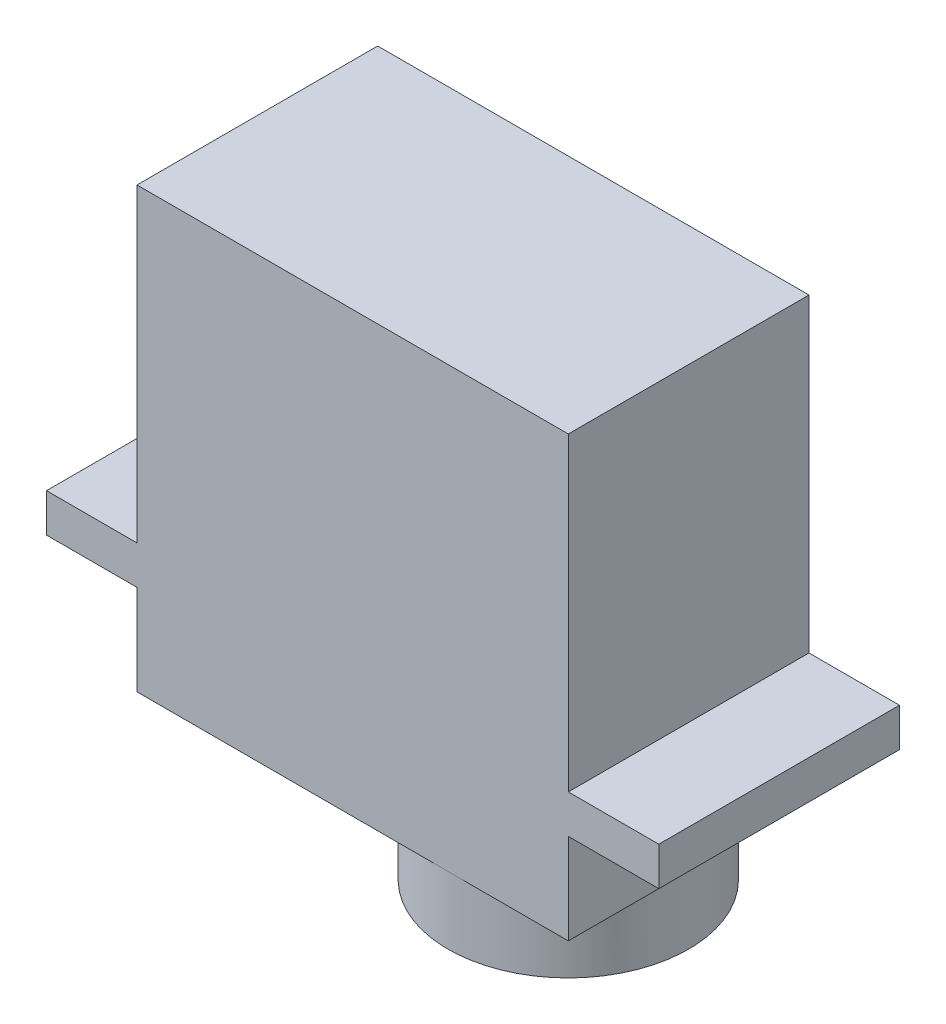
from build123d import *

# Parameters (mm, degrees)
SKETCH1_W           = 22.4
SKETCH1_H           = 12.5
BOSS_EXTRUDE1_DEPTH = 22.8
SKETCH2_W           = 12.5
SKETCH2_H           = 2
BOSS_EXTRUDE2_DEPTH = 4.7
SKETCH3_W           = 12.5
SKETCH3_H           = 2
BOSS_EXTRUDE3_DEPTH = 4.7
BOSS_EXTRUDE5_DEPTH = 3.5
SKETCH5_R           = 2.5
CUT_EXTRUDE1_DEPTH  = 5


with BuildPart() as part:
    # Sketch1 → Boss-Extrude1 (new body)
    with BuildSketch(Plane(origin=(0, 0, 0), x_dir=(1, 0, 0), z_dir=(0, 1, 0))):
        Rectangle(SKETCH1_W, SKETCH1_H)
    extrude(amount=BOSS_EXTRUDE1_DEPTH)

    # Sketch2 → Boss-Extrude2 (add)
    with BuildSketch(Plane(origin=(11.2, 0, 0), x_dir=(0, 0, -1), z_dir=(1, 0, 0))):
        with Locations((0, 5.7)):
            Rectangle(SKETCH2_W, SKETCH2_H)
    extrude(amount=BOSS_EXTRUDE2_DEPTH)

    # Sketch3 → Boss-Extrude3 (add)
    with BuildSketch(Plane.ZY.offset(11.2)):
        with Locations((0, 5.7)):
            Rectangle(SKETCH3_W, SKETCH3_H)
    extrude(amount=BOSS_EXTRUDE3_DEPTH)

    # Sketch4 → Boss-Extrude5 (add)
    with BuildSketch(Plane.XZ):
        with BuildLine():
            ThreePointArc((-0.842105263, -2.348194332), (11.2, 0), (-0.842105263, 2.348194332))
            ThreePointArc((-0.842105263, 2.348194332), (-4.2, 0), (-0.842105263, -2.348194332))
        make_face()
    extrude(amount=BOSS_EXTRUDE5_DEPTH)

    # Sketch5 → Cut-Extrude1 (cut)
    with BuildSketch(Plane.XZ.offset(3.5)):
        with Locations((4.95, 0)):
            Circle(SKETCH5_R)
    extrude(amount=-CUT_EXTRUDE1_DEPTH, mode=Mode.SUBTRACT)


solid = part.part
